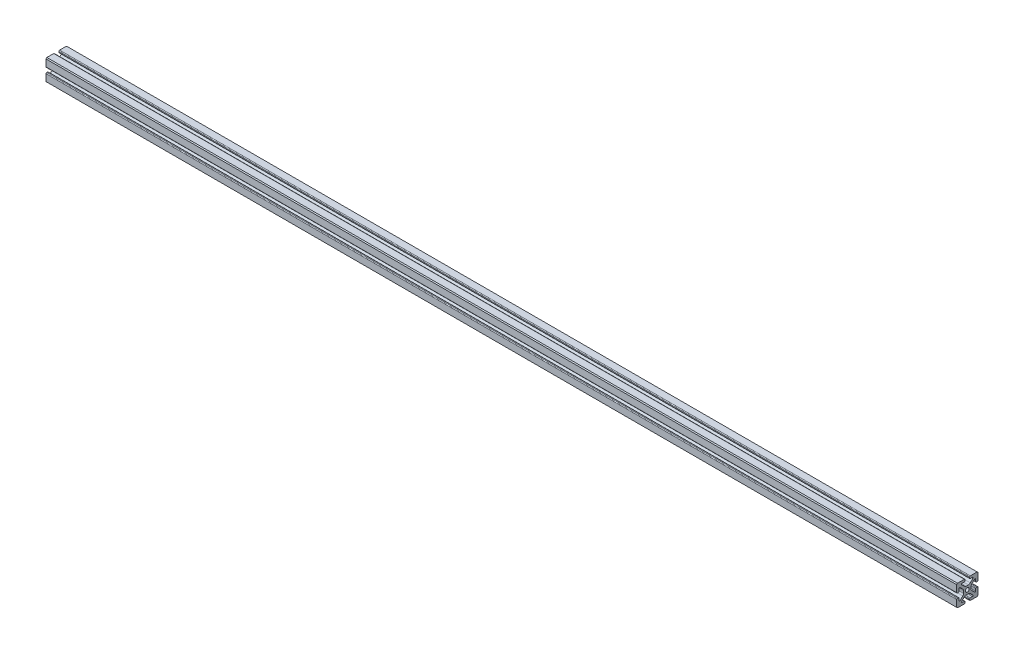
from build123d import *

# Parameters (mm, degrees)
SKETCH1_R           = 3.4036
BOSS_EXTRUDE1_DEPTH = 1625.6


with BuildPart() as part:
    # Sketch1 → Boss-Extrude1 (new body)
    with BuildSketch(Plane(origin=(0, 0, 0), x_dir=(0, -1, 0), z_dir=(-1, 0, 0))):
        with BuildLine():
            Line((19.05, 5.333992226), (19.05, 17.526))
            Line((19.05, 17.526), (17.526, 19.05))
            Line((17.526, 19.05), (5.333991729, 19.05))
            ThreePointArc((5.333991729, 19.05), (4.435966117, 18.678025612), (4.063991729, 17.78))
            Line((4.063991729, 17.78), (4.063991729, 16.12658277))
            ThreePointArc((4.063991729, 16.12658277), (4.435966117, 15.228557158), (5.333991729, 14.85658277))
            Line((5.333991729, 14.85658277), (9.096353874, 14.85658277))
            ThreePointArc((9.096353874, 14.85658277), (9.938252886, 14.507856781), (10.286978874, 13.66595777))
            Line((10.286978874, 13.66595777), (10.286978874, 13.653830065))
            ThreePointArc((10.286978874, 13.653830065), (10.196347959, 13.198197641), (9.938252944, 12.811931112))
            Line((9.938252944, 12.811931112), (5.277611896, 8.151289413))
            ThreePointArc((5.277611896, 8.151289413), (3.732545616, 7.118909013), (1.910015615, 6.756385223))
            Line((1.910015615, 6.756385223), (-1.910018596, 6.756385223))
            ThreePointArc((-1.910018596, 6.756385223), (-3.732548289, 7.118908885), (-5.277614406, 8.151288942))
            Line((-5.277614406, 8.151288942), (-9.93825393, 12.811927815))
            ThreePointArc((-9.93825393, 12.811927815), (-10.19634903, 13.198194385), (-10.286979978, 13.653826886))
            Line((-10.286979978, 13.653826886), (-10.286979978, 13.66595777))
            ThreePointArc((-10.286979978, 13.66595777), (-9.938253989, 14.507856781), (-9.096354978, 14.85658277))
            Line((-9.096354978, 14.85658277), (-5.333992226, 14.85658277))
            ThreePointArc((-5.333992226, 14.85658277), (-4.435966614, 15.228557158), (-4.063992226, 16.12658277))
            Line((-4.063992226, 16.12658277), (-4.063992226, 17.78))
            ThreePointArc((-4.063992226, 17.78), (-4.435966614, 18.678025612), (-5.333992226, 19.05))
            Line((-5.333992226, 19.05), (-17.526, 19.05))
            Line((-17.526, 19.05), (-19.05, 17.526))
            Line((-19.05, 17.526), (-19.05, 5.333992226))
            ThreePointArc((-19.05, 5.333992226), (-18.678025612, 4.435966614), (-17.78, 4.063992226))
            Line((-17.78, 4.063992226), (-16.12658277, 4.063992226))
            ThreePointArc((-16.12658277, 4.063992226), (-15.228557158, 4.435966614), (-14.85658277, 5.333992226))
            Line((-14.85658277, 5.333992226), (-14.85658277, 9.096354978))
            ThreePointArc((-14.85658277, 9.096354978), (-14.507856781, 9.938253989), (-13.66595777, 10.286979978))
            Line((-13.66595777, 10.286979978), (-13.653827218, 10.286979978))
            ThreePointArc((-13.653827218, 10.286979978), (-13.198194795, 10.196349062), (-12.811928266, 9.938254048))
            Line((-12.811928266, 9.938254048), (-8.151289413, 5.277615846))
            ThreePointArc((-8.151289413, 5.277615846), (-7.118909013, 3.732549566), (-6.756385223, 1.910019566))
            Line((-6.756385223, 1.910019566), (-6.756385223, -1.910017492))
            ThreePointArc((-6.756385223, -1.910017492), (-7.118908885, -3.732547185), (-8.151288942, -5.277613302))
            Line((-8.151288942, -5.277613302), (-12.811927815, -9.938252827))
            ThreePointArc((-12.811927815, -9.938252827), (-13.198194385, -10.196347927), (-13.653826886, -10.286978874))
            Line((-13.653826886, -10.286978874), (-13.66595777, -10.286978874))
            ThreePointArc((-13.66595777, -10.286978874), (-14.507856781, -9.938252886), (-14.85658277, -9.096353874))
            Line((-14.85658277, -9.096353874), (-14.85658277, -5.333991729))
            ThreePointArc((-14.85658277, -5.333991729), (-15.228557158, -4.435966117), (-16.12658277, -4.063991729))
            Line((-16.12658277, -4.063991729), (-17.78, -4.063991729))
            ThreePointArc((-17.78, -4.063991729), (-18.678025612, -4.435966117), (-19.05, -5.333991729))
            Line((-19.05, -5.333991729), (-19.05, -17.526))
            Line((-19.05, -17.526), (-17.526, -19.05))
            Line((-17.526, -19.05), (-5.333992226, -19.05))
            ThreePointArc((-5.333992226, -19.05), (-4.435966614, -18.678025612), (-4.063992226, -17.78))
            Line((-4.063992226, -17.78), (-4.063992226, -16.126583724))
            ThreePointArc((-4.063992226, -16.126583724), (-4.435966614, -15.228558112), (-5.333992226, -14.856583724))
            Line((-5.333992226, -14.856583724), (-9.096354978, -14.856583724))
            ThreePointArc((-9.096354978, -14.856583724), (-9.938253989, -14.507857736), (-10.286979978, -13.665958724))
            Line((-10.286979978, -13.665958724), (-10.286979978, -13.653828173))
            ThreePointArc((-10.286979978, -13.653828173), (-10.196349062, -13.198195749), (-9.938254048, -12.81192922))
            Line((-9.938254048, -12.81192922), (-5.277615159, -8.15128968))
            ThreePointArc((-5.277615159, -8.15128968), (-3.732548878, -7.11890928), (-1.910018878, -6.75638549))
            Line((-1.910018878, -6.75638549), (1.910021709, -6.75638549))
            ThreePointArc((1.910021709, -6.75638549), (3.732551402, -7.118909152), (5.277617519, -8.151289209))
            Line((5.277617519, -8.151289209), (9.938252827, -12.811923865))
            ThreePointArc((9.938252827, -12.811923865), (10.196347927, -13.198190435), (10.286978874, -13.653822935))
            Line((10.286978874, -13.653822935), (10.286978874, -13.665958724))
            ThreePointArc((10.286978874, -13.665958724), (9.938252886, -14.507857736), (9.096353874, -14.856583724))
            Line((9.096353874, -14.856583724), (5.333991729, -14.856583724))
            ThreePointArc((5.333991729, -14.856583724), (4.435966117, -15.228558112), (4.063991729, -16.126583724))
            Line((4.063991729, -16.126583724), (4.063991729, -17.78))
            ThreePointArc((4.063991729, -17.78), (4.435966117, -18.678025612), (5.333991729, -19.05))
            Line((5.333991729, -19.05), (17.526, -19.05))
            Line((17.526, -19.05), (19.05, -17.526))
            Line((19.05, -17.526), (19.05, -5.333991729))
            ThreePointArc((19.05, -5.333991729), (18.678025612, -4.435966117), (17.78, -4.063991729))
            Line((17.78, -4.063991729), (16.126583724, -4.063991729))
            ThreePointArc((16.126583724, -4.063991729), (15.228558112, -4.435966117), (14.856583724, -5.333991729))
            Line((14.856583724, -5.333991729), (14.856583724, -9.096353874))
            ThreePointArc((14.856583724, -9.096353874), (14.507857736, -9.938252886), (13.665958724, -10.286978874))
            Line((13.665958724, -10.286978874), (13.653828961, -10.286978874))
            ThreePointArc((13.653828961, -10.286978874), (13.198196538, -10.196347959), (12.811930009, -9.938252944))
            Line((12.811930009, -9.938252944), (8.151290074, -5.277613661))
            ThreePointArc((8.151290074, -5.277613661), (7.118909674, -3.732547381), (6.756385884, -1.91001738))
            Line((6.756385884, -1.91001738), (6.756385884, 1.910021149))
            ThreePointArc((6.756385884, 1.910021149), (7.118909547, 3.732550842), (8.151289603, 5.277616959))
            Line((8.151289603, 5.277616959), (12.811925923, 9.93825393))
            ThreePointArc((12.811925923, 9.93825393), (13.198192493, 10.19634903), (13.653824993, 10.286979978))
            Line((13.653824993, 10.286979978), (13.665958724, 10.286979978))
            ThreePointArc((13.665958724, 10.286979978), (14.507857736, 9.938253989), (14.856583724, 9.096354978))
            Line((14.856583724, 9.096354978), (14.856583724, 5.333992226))
            ThreePointArc((14.856583724, 5.333992226), (15.228558112, 4.435966614), (16.126583724, 4.063992226))
            Line((16.126583724, 4.063992226), (17.78, 4.063992226))
            ThreePointArc((17.78, 4.063992226), (18.678025612, 4.435966614), (19.05, 5.333992226))
        make_face()
        Circle(SKETCH1_R, mode=Mode.SUBTRACT)
    extrude(amount=-BOSS_EXTRUDE1_DEPTH)


solid = part.part
